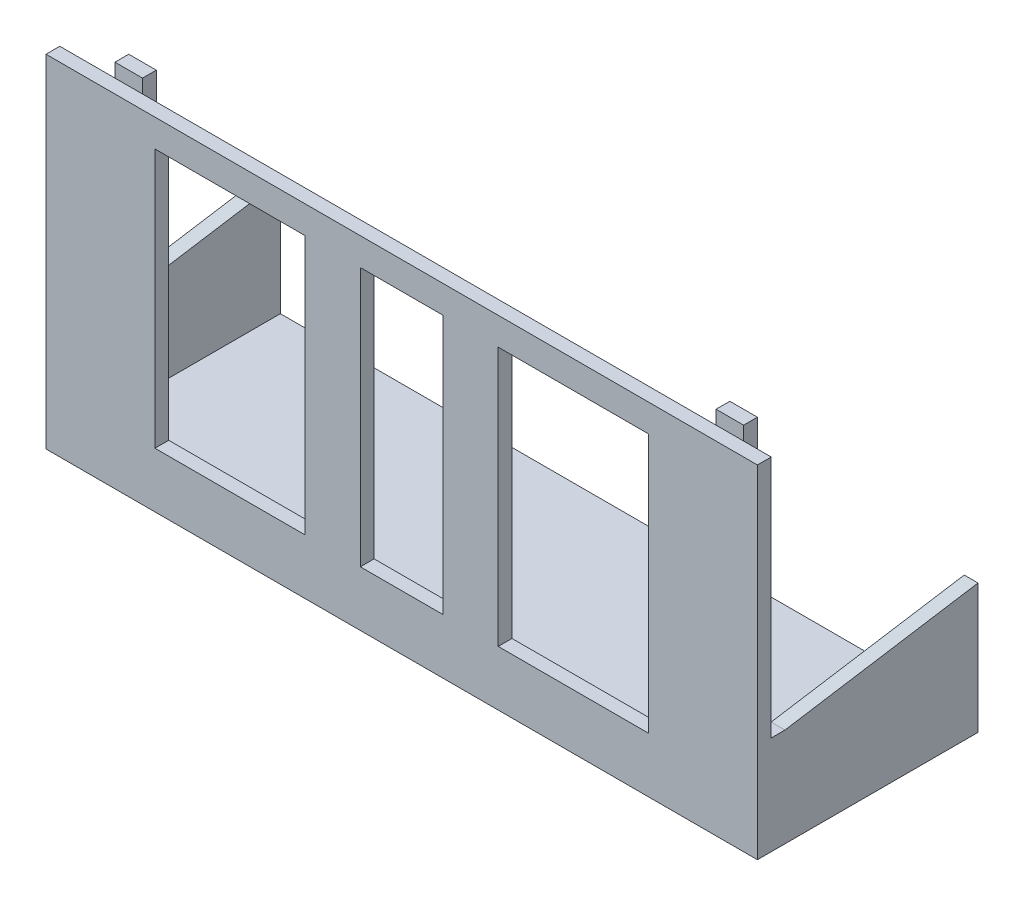
from build123d import *

# Parameters (mm, degrees)
SKETCH_2_W      = 49.600012207
SKETCH_2_H      = 22.800017408
SKETCH_2_W_2    = 10.900003052
SKETCH_2_H_2    = 18.800017408
SKETCH_2_W_3    = 6
SKETCH_2_W_4    = 10.900003051
EXTRUDE_1_DEPTH = 1
SKETCH_4_W      = 49.600012207
SKETCH_4_H      = 1
EXTRUDE_2_DEPTH = 2
SKETCH_5_W      = 49.600012207
SKETCH_5_H      = 1
EXTRUDE_3_DEPTH = 15
SKETCH_6_W      = 1
SKETCH_6_H      = 17.650008704
EXTRUDE_6_DEPTH = 1
SKETCH_7_W      = 2
SKETCH_7_H      = 2
EXTRUDE_7_DEPTH = 2
SKETCH_8_W      = 2
SKETCH_8_H      = 1
EXTRUDE_8_DEPTH = 2
CHAMFER_1_SIZE  = 2


with BuildPart() as part:
    # Эскиз2 → Бобышка-Вытянуть1 (new body)
    with BuildSketch(Plane.XY):
        with Locations((22.600006104, 10.200008704)):
            Rectangle(SKETCH_2_W, SKETCH_2_H)
        with Locations((10.150004578, 10.200008704)):
            Rectangle(SKETCH_2_W_2, SKETCH_2_H_2, mode=Mode.SUBTRACT)
        with Locations((22.600006104, 10.200008704)):
            Rectangle(SKETCH_2_W_3, SKETCH_2_H_2, mode=Mode.SUBTRACT)
        with Locations((35.05000763, 10.200008704)):
            Rectangle(SKETCH_2_W_4, SKETCH_2_H_2, mode=Mode.SUBTRACT)
    extrude(amount=EXTRUDE_1_DEPTH)

    # Эскиз4 → Бобышка-Вытянуть2 (add)
    with BuildSketch(Plane.XZ.offset(1.2)):
        with Locations((22.600006104, 0.5)):
            Rectangle(SKETCH_4_W, SKETCH_4_H)
    extrude(amount=EXTRUDE_2_DEPTH)

    # Эскиз5 → Бобышка-Вытянуть3 (add)
    with BuildSketch(Plane(origin=(0, 0, 0), x_dir=(-1, 0, 0), z_dir=(0, 0, -1))):
        with Locations((-22.600006104, -2.7)):
            Rectangle(SKETCH_5_W, SKETCH_5_H)
    extrude(amount=EXTRUDE_3_DEPTH)

    # Эскиз6 → Бобышка-Вытянуть6 (add)
    with BuildSketch(Plane.ZY.offset(2.2)):
        with Locations((0.5, 12.775013056)):
            Rectangle(SKETCH_6_W, SKETCH_6_H)
        Polygon((1, 3.950008704), (0, 3.950008704), (0, -2.2), (-15, -2.2), (-15, -3.2), (1, -3.2), align=None)
        Polygon((0, -2.2), (0, 3.950008704), (-1, 3.950008704), (-15, 6.184703554), (-15, -2.2), align=None)
    extrude_6 = extrude(amount=EXTRUDE_6_DEPTH)

    # Зеркальное отражение1: Бобышка-Вытянуть6 across plane
    add(extrude_6.mirror(Plane.ZY.offset(-22.600006104)))

    # Эскиз7 → Бобышка-Вытянуть7 (add)
    with BuildSketch(Plane(origin=(0, 0, 0), x_dir=(-1, 0, 0), z_dir=(0, 0, -1))):
        with Locations((-44.400012207, 18.600017408)):
            Rectangle(SKETCH_7_W, SKETCH_7_H)
        with Locations((-0.8, 18.600017408)):
            Rectangle(SKETCH_7_W, SKETCH_7_H)
    extrude(amount=EXTRUDE_7_DEPTH)

    # Эскиз8 → Бобышка-Вытянуть8 (add)
    with BuildSketch(Plane(origin=(0, 19.600017408, 0), x_dir=(1, 0, 0), z_dir=(0, 1, 0))):
        with Locations((0.8, 1.5)):
            Rectangle(SKETCH_8_W, SKETCH_8_H)
        with Locations((44.400012207, 1.5)):
            Rectangle(SKETCH_8_W, SKETCH_8_H)
    extrude(amount=EXTRUDE_8_DEPTH)

    # Фаска1
    chamfer_1_edges = [part.edges().sort_by_distance(p)[0] for p in [
        (0.8, 17.600017408, -2),
        (44.400012207, 17.600017408, -2),
    ]]
    chamfer(chamfer_1_edges, length=CHAMFER_1_SIZE - 0.0001)  # a hair under: the kernel refuses the full size


solid = part.part
